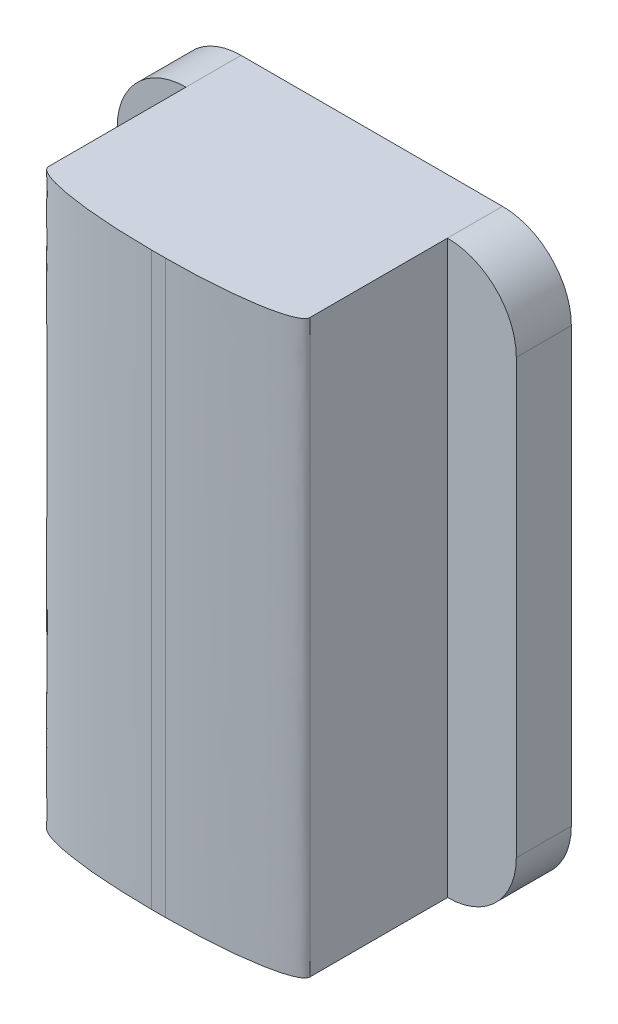
from build123d import *

# Parameters (mm, degrees)
EXTRUDE_1_DEPTH          = 3.1
EXTRUDE_2_DEPTH          = 0.8
FILLET_1_SIZE            = 0.3
FILLET_1_SIZE_2          = 1.8
SKETCH_3_R               = 1
SKETCH_3_R_2             = 1.096749421
EXTRUDE_3_DEPTH          = 1.05
FILLET_5_R               = 0.9
CUT_EXTRUDE_2_DEPTH      = 82.307539193
CUT_EXTRUDE_2_DEPTH_BACK = 82.307539193
SKETCH_7_W               = 25.8
SKETCH_7_H               = 28.300000874
SKETCH_7_W_2             = 5.8
SKETCH_7_H_2             = 8.300000874
FILLET_6_R               = 1


with BuildPart() as part:
    # 草图1 → 凸台-拉伸1 (new body)
    with BuildSketch(Plane.XY):
        with BuildLine():
            Line((-1.3, -78.273), (-1.3, -61.672998253))
            ThreePointArc((-1.3, -61.672998253), (0.6, -59.772998253), (2.5, -61.672998253))
            Line((2.5, -61.672998253), (2.5, -78.273))
            ThreePointArc((2.5, -78.273), (0.6, -80.173), (-1.3, -78.273))
        make_face()
    extrude(amount=EXTRUDE_1_DEPTH)

    # 草图2 → 凸台-拉伸2 (add)
    with BuildSketch(Plane(origin=(0, 0, 0), x_dir=(-1, 0, 0), z_dir=(0, 0, -1))):
        with BuildLine():
            Line((2.3, -78.273), (2.3, -61.672998253))
            ThreePointArc((2.3, -61.672998253), (-0.6, -58.772998253), (-3.5, -61.672998253))
            Line((-3.5, -61.672998253), (-3.5, -78.273))
            ThreePointArc((-3.5, -78.273), (-0.6, -81.173), (2.3, -78.273))
        make_face()
    extrude(amount=-EXTRUDE_2_DEPTH)

    # 圆角1
    # an asymmetric fillet: 1.8, 0.3 mm, written as the material it takes off along each edge
    with BuildSketch(Plane(origin=(2.5, -61.672998253, 3.1), x_dir=(0, 0, -1), z_dir=(0, -1, 0)), Plane(origin=(-1.3, -78.273, 3.1), x_dir=(0, 0, -1), z_dir=(0, 1, 0))) as fillet_1_piece_1:
        with BuildLine():
            Bezier((FILLET_1_SIZE, 0), (0, 0), (0, -FILLET_1_SIZE_2), weights=[1, 0.707106781, 1])
            Line((0, -FILLET_1_SIZE_2), (0, 0))
            Line((0, 0), (FILLET_1_SIZE, 0))
        make_face()
    extrude(amount=16.600001747, mode=Mode.SUBTRACT)
    with BuildSketch(Plane(origin=(0.6, -61.672998253, 3.1), x_dir=(-1, 0, 0), z_dir=(0, -1, 0))) as fillet_1_piece_2:
        with BuildLine():
            Bezier((1.9, FILLET_1_SIZE), (1.9, 0), (1.9 - FILLET_1_SIZE_2, 0), weights=[1, 0.707106781, 1])
            Line((1.9 - FILLET_1_SIZE_2, 0), (1.9, 0))
            Line((1.9, 0), (1.9, FILLET_1_SIZE))
        make_face()
    revolve(axis=Axis((0.6, -61.672998253, 3.1), (0, 0, -1)), revolution_arc=180, mode=Mode.SUBTRACT)
    with BuildSketch(Plane(origin=(0.6, -78.273, 3.1), x_dir=(1, 0, 0), z_dir=(0, 1, 0))) as fillet_1_piece_3:
        with BuildLine():
            Bezier((1.9, FILLET_1_SIZE), (1.9, 0), (1.9 - FILLET_1_SIZE_2, 0), weights=[1, 0.707106781, 1])
            Line((1.9 - FILLET_1_SIZE_2, 0), (1.9, 0))
            Line((1.9, 0), (1.9, FILLET_1_SIZE))
        make_face()
    revolve(axis=Axis((0.6, -78.273, 3.1), (0, 0, -1)), revolution_arc=180, mode=Mode.SUBTRACT)

    # 草图3 → 凸台-拉伸3 (add)
    with BuildSketch(Plane(origin=(0, 0, 0), x_dir=(-1, 0, 0), z_dir=(0, 0, -1))):
        with Locations(Location((-0.6, -61.672998253, 0), (0, 0, 180))):
            Circle(SKETCH_3_R)
        with Locations(Location((-0.6, -69.972999126, 0), (0, 0, 180))):
            Circle(SKETCH_3_R_2)
        with Locations(Location((-0.6, -78.273, 0), (0, 0, 180))):
            Circle(SKETCH_3_R_2)
    extrude(amount=EXTRUDE_3_DEPTH)

    # 圆角5
    fillet_5_edges = [part.edges().sort_by_distance(p)[0] for p in [
        (-0.4, -61.672998253, 0),
        (-0.496749421, -69.972999126, 0),
        (-0.496749421, -78.273, 0),
    ]]
    fillet(fillet_5_edges, radius=FILLET_5_R)

    # 草图7 → 切除-拉伸2 (cut, two sides: drawn at the far end of the back side and taken through both)
    with BuildSketch(Plane(origin=(0, 0, 0), x_dir=(-1, 0, 0), z_dir=(0, 0, -1)).offset(-CUT_EXTRUDE_2_DEPTH_BACK)):
        with Locations((-0.6, -69.972999126)):
            Rectangle(SKETCH_7_W, SKETCH_7_H)
        with Locations((-0.6, -69.972999126)):
            Rectangle(SKETCH_7_W_2, SKETCH_7_H_2, mode=Mode.SUBTRACT)
    extrude(amount=CUT_EXTRUDE_2_DEPTH + CUT_EXTRUDE_2_DEPTH_BACK, mode=Mode.SUBTRACT)

    # 圆角6
    fillet_6_edges = [part.edges().sort_by_distance(p)[0] for p in [
        (3.5, -74.122999563, 0.4),
        (3.5, -65.822998689, 0.4),
        (-2.3, -65.822998689, 0.4),
        (-2.3, -74.122999563, 0.4),
    ]]
    fillet(fillet_6_edges, radius=FILLET_6_R)


solid = part.part
